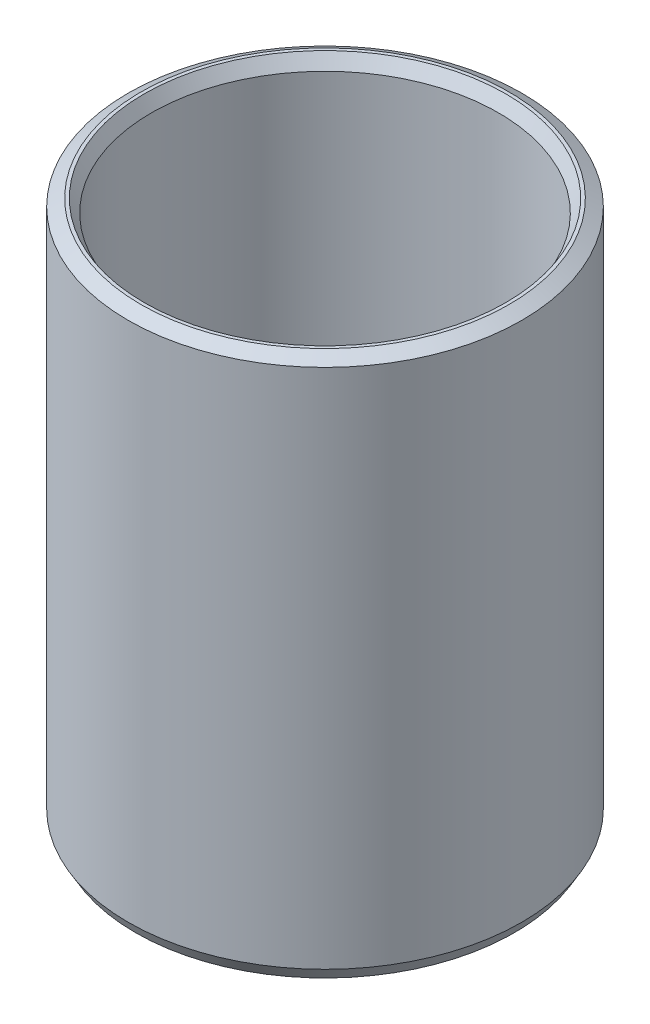
from build123d import *
from OCP.BRepFilletAPI import BRepFilletAPI_MakeChamfer

# Parameters (mm, degrees)
SKETCH1_R           = 60
BOSS_EXTRUDE1_DEPTH = 165.018270107
SKETCH2_R           = 52.886756292
CUT_EXTRUDE1_DEPTH  = 186.556000898
CHAMFER1_SIZE       = 2.237788325
CHAMFER1_SIZE2      = 3.875963075


with BuildPart() as part:
    # Sketch1 → Boss-Extrude1 (new body)
    with BuildSketch(Plane(origin=(0, 0, 0), x_dir=(1, 0, 0), z_dir=(0, 1, 0))):
        Circle(SKETCH1_R)
    extrude(amount=BOSS_EXTRUDE1_DEPTH)

    # Sketch2 → Cut-Extrude1 (cut, through all)
    with BuildSketch(Plane(origin=(0, 0, 0), x_dir=(1, 0, 0), z_dir=(0, 1, 0))):
        Circle(SKETCH2_R)
    extrude(amount=CUT_EXTRUDE1_DEPTH, mode=Mode.SUBTRACT)

    # Chamfer1: one chamfer whose edges measure the first distance from different faces: ONE call of the kernel's chamfer builder (chamfer() names one face for all edges)
    chamfer1_edges_1 = [part.edges().sort_by_distance(p)[0] for p in [
        (-52.886756292, 165.018270107, 0),
    ]]
    chamfer1_side_1 = [part.faces().sort_by_distance(p)[0] for p in [
        (-58.302943725, 165.018270107, 0),
    ]]
    chamfer1_edges_2 = [part.edges().sort_by_distance(p)[0] for p in [
        (-52.886756292, 0, 0),
    ]]
    chamfer1_side_2 = [part.faces().sort_by_distance(p)[0] for p in [
        (-52.886756292, 82.509135054, 0),
    ]]
    chamfer1_edges_3 = [part.edges().sort_by_distance(p)[0] for p in [
        (-60, 0, 0),
    ]]
    chamfer1_side_3 = [part.faces().sort_by_distance(p)[0] for p in [
        (-58.302943725, 0, 0),
    ]]
    chamfer1_edges_4 = [part.edges().sort_by_distance(p)[0] for p in [
        (-60, 165.018270107, 0),
    ]]
    chamfer1_side_4 = [part.faces().sort_by_distance(p)[0] for p in [
        (-60, 82.509135054, 0),
    ]]
    chamfer1 = BRepFilletAPI_MakeChamfer(part.part.solid().wrapped)
    for e in chamfer1_edges_1:
        chamfer1.Add(CHAMFER1_SIZE, CHAMFER1_SIZE2, e.wrapped, chamfer1_side_1[0].wrapped)  # the first distance lies on this face
    for e in chamfer1_edges_2:
        chamfer1.Add(CHAMFER1_SIZE, CHAMFER1_SIZE2, e.wrapped, chamfer1_side_2[0].wrapped)  # the first distance lies on this face
    for e in chamfer1_edges_3:
        chamfer1.Add(CHAMFER1_SIZE, CHAMFER1_SIZE2, e.wrapped, chamfer1_side_3[0].wrapped)  # the first distance lies on this face
    for e in chamfer1_edges_4:
        chamfer1.Add(CHAMFER1_SIZE, CHAMFER1_SIZE2, e.wrapped, chamfer1_side_4[0].wrapped)  # the first distance lies on this face
    add(Compound.cast(chamfer1.Shape()), mode=Mode.REPLACE)


solid = part.part
